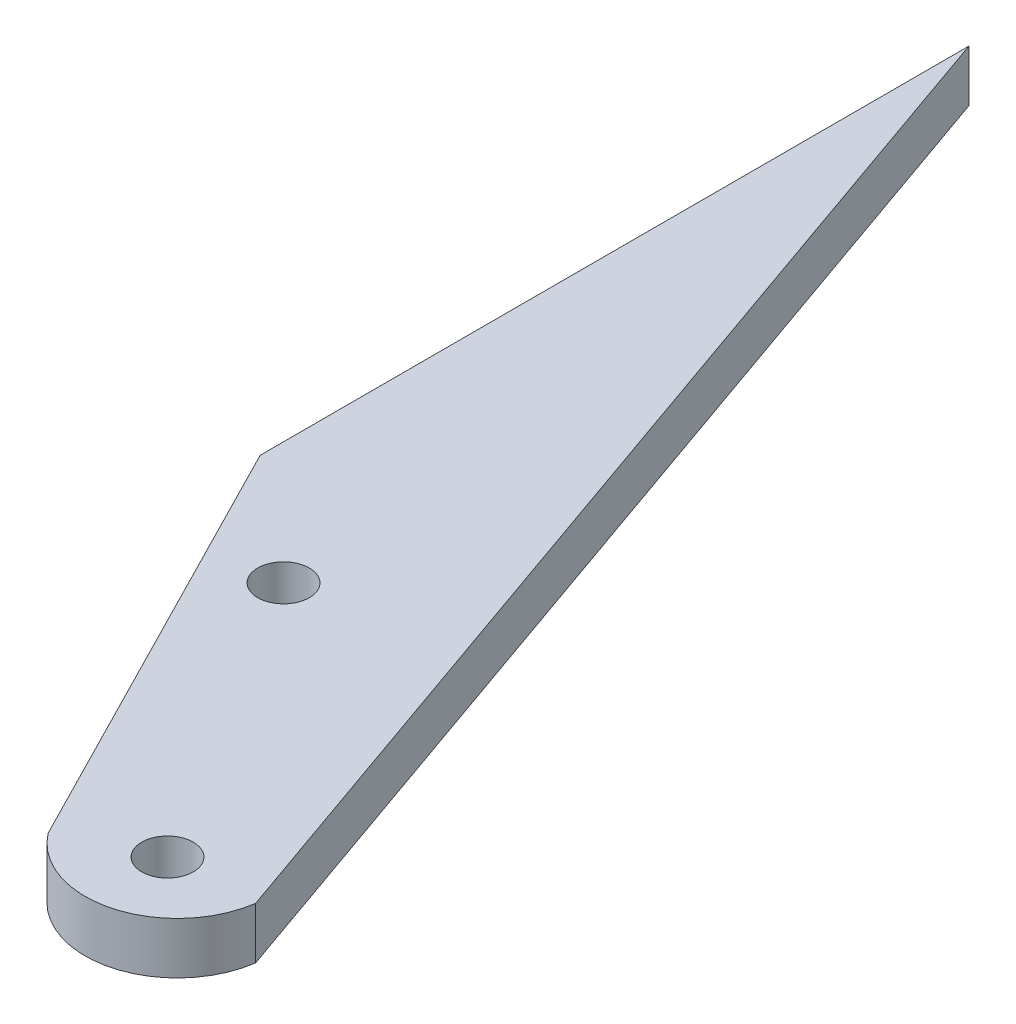
from build123d import *

# Parameters (mm, degrees)
SKETCH1_R           = 1.5
BOSS_EXTRUDE1_DEPTH = 3


with BuildPart() as part:
    # Sketch1 → Boss-Extrude1 (new body)
    with BuildSketch(Plane(origin=(0, 0, 0), x_dir=(1, 0, 0), z_dir=(0, 1, 0))):
        with BuildLine():
            Line((-22.443608406, 63.945737479), (-22.443608406, 22.705737479))
            Line((-22.443608406, 22.705737479), (-9.573677497, -2.498525621))
            ThreePointArc((-9.573677497, -2.498525621), (-3.954490329, -4.438597859), (0, 0))
            Line((0, 0), (-22.443608406, 63.945737479))
        make_face()
        with Locations((-15.336480405, 16.958709415)):
            Circle(SKETCH1_R, mode=Mode.SUBTRACT)
        with Locations((-4.897949582, -0.229925617)):
            Circle(SKETCH1_R, mode=Mode.SUBTRACT)
    extrude(amount=BOSS_EXTRUDE1_DEPTH)


solid = part.part
